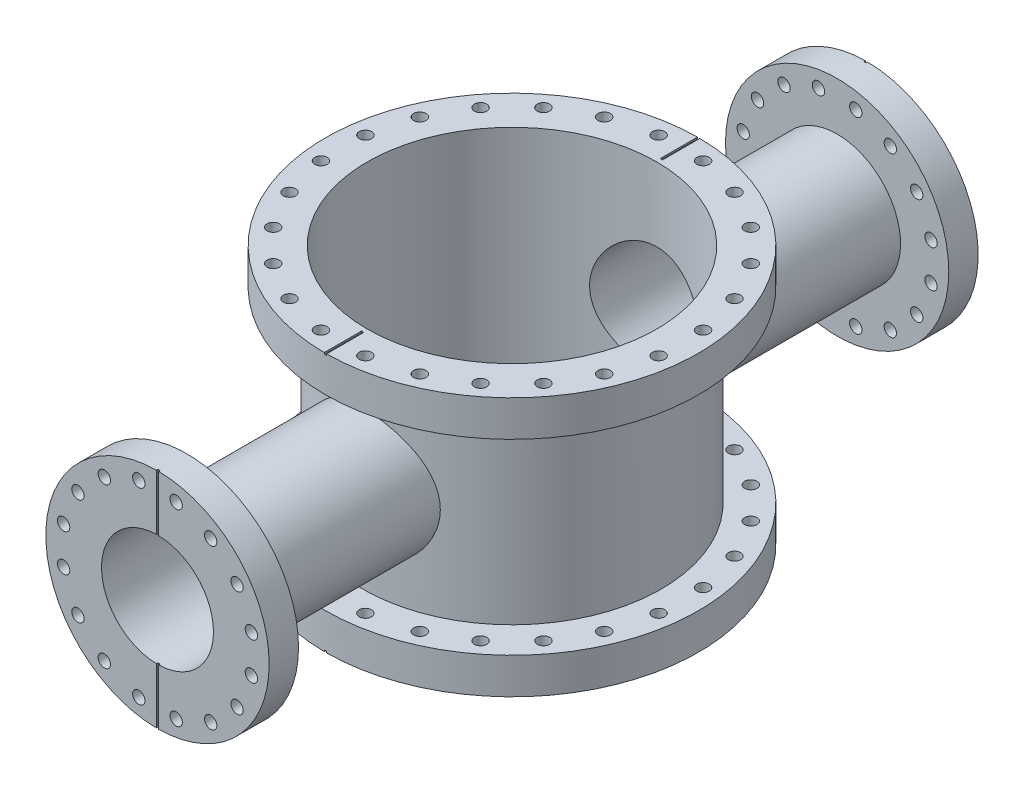
from build123d import *

# Parameters (mm, degrees)
MAIN_CHAMBER_CYLINDER_DEPTH             = 88.138
MAIN_CHAMBER_CYLINDER_DEPTH_BACK        = 88.138
MAIN_CHAMBER_CYLINDER_CROSS_SECTION_R   = 101.6
MAIN_CHAMBER_CYLINDER_CROSS_SECTION_R_2 = 98.552
SKETCH21_R                              = 127
SKETCH21_R_2                            = 101.6
EXTRUDE2_DEPTH                          = 24.5
SKETCH5_W                               = 1.5875
SKETCH5_H                               = 50.8
EXTRUDE3_DEPTH                          = 1.016
HOLE5_D                                 = 8.4
CIRPATTERN7_COUNT                       = 24
EXTRUDE21_START                         = -24.5
SKETCH22_R                              = 127
SKETCH22_R_2                            = 101.6
EXTRUDE21_DEPTH                         = 24.5
SKETCH51_W                              = 1.5875
SKETCH51_H                              = 50.8
EXTRUDE31_DEPTH                         = 1.016
HOLE51_D                                = 8.4
CIRPATTERN71_COUNT                      = 24
EXTRUDE32_REACH                         = 401.427
EXTRUDE32_END_RADIUS                    = 101.6
SKETCH92_R                              = 43.18
SKETCH92_R_2                            = 38.1
EXTRUDE33_REACH                         = 401.427
SKETCH93_R                              = 38.1
SKETCH23_R                              = 76.0000004
SKETCH23_R_2                            = 38.1
EXTRUDE22_DEPTH                         = 20
SKETCH52_W                              = 1.5875
SKETCH52_H                              = 152.0000008
EXTRUDE35_DEPTH                         = 1.016
EXTRUDE4_REACH                          = 401.427
SKETCH8_R                               = 4.2
CIRPATTERN1_COUNT                       = 16
SKETCH24_R                              = 76.0000004
SKETCH24_R_2                            = 38.1
EXTRUDE23_DEPTH                         = 20
SKETCH53_W                              = 1.5875
SKETCH53_H                              = 152.0000008
EXTRUDE37_DEPTH                         = 1.016
EXTRUDE41_REACH                         = 508.754
SKETCH81_R                              = 4.2
CIRPATTERN11_COUNT                      = 16


with BuildPart() as part:
    # Main_Chamber_Cylinder_Cross_Section → Main_Chamber_Cylinder (new, two sides: drawn at the far end of the back side and taken through both)
    with BuildSketch(Plane(origin=(0, 0, 0), x_dir=(1, 0, 0), z_dir=(0, 1, 0)).offset(-MAIN_CHAMBER_CYLINDER_DEPTH_BACK)):
        with Locations(Location((0, 0, 0), (0, 0, 270))):
            Circle(MAIN_CHAMBER_CYLINDER_CROSS_SECTION_R)
        with Locations(Location((0, 0, 0), (0, 0, 270))):
            Circle(MAIN_CHAMBER_CYLINDER_CROSS_SECTION_R_2, mode=Mode.SUBTRACT)
    extrude(amount=MAIN_CHAMBER_CYLINDER_DEPTH + MAIN_CHAMBER_CYLINDER_DEPTH_BACK)

    # Sketch21 → Extrude2 (add)
    with BuildSketch(Plane.XZ.offset(88.138)):
        with Locations(Location((0, 0, 0), (0, 0, 270))):
            Circle(SKETCH21_R)
        with Locations(Location((0, 0, 0), (0, 0, 270))):
            Circle(SKETCH21_R_2, mode=Mode.SUBTRACT)
    extrude(amount=-EXTRUDE2_DEPTH)

    # Sketch5 → Extrude3 (cut)
    with BuildSketch(Plane.XZ.offset(88.138)):
        with Locations((0, 127.0500126)):
            Rectangle(SKETCH5_W, SKETCH5_H)
        with Locations((0, -127.0500126)):
            Rectangle(SKETCH5_W, SKETCH5_H)
    extrude(amount=-EXTRUDE3_DEPTH, mode=Mode.SUBTRACT)

    # Hole5 (through all)
    with Locations(Plane(origin=(15.131327149, -88.138, 114.933840422), x_dir=(0, 0, -1), z_dir=(0, -1, 0))):
        with Locations((0, 0)):
            hole5 = Hole(HOLE5_D / 2)

    # CirPattern7: Hole5 ×24 about axis
    cirpattern7_axis = Axis((0, 0, 0), (0, 1, 0))
    for i in range(1, CIRPATTERN7_COUNT):
        add(hole5.rotate(cirpattern7_axis, i * 360 / CIRPATTERN7_COUNT), mode=Mode.SUBTRACT)

    # Sketch22 → Extrude21 (add)
    with BuildSketch(Plane(origin=(0, 88.138, 0), x_dir=(-1, 0, 0), z_dir=(0, 1, 0)).offset(EXTRUDE21_START)):
        with Locations(Location((0, 0, 0), (0, 0, 270))):
            Circle(SKETCH22_R)
        with Locations(Location((0, 0, 0), (0, 0, 270))):
            Circle(SKETCH22_R_2, mode=Mode.SUBTRACT)
    extrude(amount=EXTRUDE21_DEPTH)

    # Sketch51 → Extrude31 (cut)
    with BuildSketch(Plane(origin=(0, 88.138, 0), x_dir=(-1, 0, 0), z_dir=(0, 1, 0))):
        with Locations((0, -127.0500126)):
            Rectangle(SKETCH51_W, SKETCH51_H)
        with Locations((0, 127.0500126)):
            Rectangle(SKETCH51_W, SKETCH51_H)
    extrude(amount=-EXTRUDE31_DEPTH, mode=Mode.SUBTRACT)

    # Hole51 (through all)
    with Locations(Plane(origin=(15.131327149, 88.138, -114.933840422), x_dir=(0, 0, 1), z_dir=(0, 1, 0))):
        with Locations((0, 0)):
            hole51 = Hole(HOLE51_D / 2)

    # CirPattern71: Hole51 ×24 about axis
    cirpattern71_axis = Axis((0, 0, 0), (0, 1, 0))
    for i in range(1, CIRPATTERN71_COUNT):
        add(hole51.rotate(cirpattern71_axis, i * 360 / CIRPATTERN71_COUNT), mode=Mode.SUBTRACT)

    # Extrude32: up to this cylinder (the profile starts outside it)
    extrude32_end = Plane(origin=(0, 0, 0), z_dir=(0, -1, 0)) * Cylinder(EXTRUDE32_END_RADIUS, 1007.054, mode=Mode.PRIVATE)
    # Sketch92 → Extrude32 (add, up to the surface)
    with BuildSketch(Plane.XY.offset(241.3), mode=Mode.PRIVATE) as extrude32_sk1:
        Circle(SKETCH92_R)
        Circle(SKETCH92_R_2, mode=Mode.SUBTRACT)
    extrude32_tool1 = extrude(extrude32_sk1.sketch, amount=-EXTRUDE32_REACH, mode=Mode.PRIVATE) - extrude32_end
    extrude32 = extrude32_tool1.solids().sort_by_distance((-41.958685, 0, 241.3))[0]
    add(extrude32)

    # Sketch93 → Extrude33 (cut, up to next)
    with BuildSketch(Plane.XY.offset(241.3), mode=Mode.PRIVATE) as extrude33_sk1:
        Circle(SKETCH93_R)
    extrude33_tool1 = extrude(extrude33_sk1.sketch, amount=-EXTRUDE33_REACH, mode=Mode.PRIVATE) & part.part
    extrude33 = extrude33_tool1.solids().sort_by_distance((0, 0, 241.3))[0]
    add(extrude33, mode=Mode.SUBTRACT)

    # Sketch23 → Extrude22 (add)
    with BuildSketch(Plane.XY.offset(241.3)):
        Circle(SKETCH23_R)
        Circle(SKETCH23_R_2, mode=Mode.SUBTRACT)
    extrude(amount=-EXTRUDE22_DEPTH)

    # Sketch52 → Extrude35 (cut)
    with BuildSketch(Plane.XY.offset(241.3)):
        Rectangle(SKETCH52_W, SKETCH52_H)
    extrude(amount=-EXTRUDE35_DEPTH, mode=Mode.SUBTRACT)

    # Sketch8 → Extrude4 (cut, up to next)
    with BuildSketch(Plane.XY.offset(241.3), mode=Mode.PRIVATE) as extrude4_sk1:
        with Locations((12.710134479, 63.898161018)):
            Circle(SKETCH8_R)
    extrude4_tool1 = extrude(extrude4_sk1.sketch, amount=-EXTRUDE4_REACH, mode=Mode.PRIVATE) & part.part
    extrude4 = extrude4_tool1.solids().sort_by_distance((12.710134, 63.898161, 241.3))[0]
    add(extrude4, mode=Mode.SUBTRACT)

    # CirPattern1: Extrude4 ×16 about axis
    cirpattern1_axis = Axis((0, 0, 0), (0, 0, 1))
    for i in range(1, CIRPATTERN1_COUNT):
        add(extrude4.rotate(cirpattern1_axis, i * 360 / CIRPATTERN1_COUNT), mode=Mode.SUBTRACT)

    # Mirror2: Extrude32, Extrude33 across plane
    add(extrude32.mirror(Plane.XY))
    add(extrude33.mirror(Plane.XY), mode=Mode.SUBTRACT)

    # Sketch24 → Extrude23 (add)
    with BuildSketch(Plane(origin=(0, 0, -241.3), x_dir=(-1, 0, 0), z_dir=(0, 0, -1))):
        with Locations(Location((0, 0, 0), (0, 0, 180))):
            Circle(SKETCH24_R)
        with Locations(Location((0, 0, 0), (0, 0, 180))):
            Circle(SKETCH24_R_2, mode=Mode.SUBTRACT)
    extrude(amount=-EXTRUDE23_DEPTH)

    # Sketch53 → Extrude37 (cut)
    with BuildSketch(Plane(origin=(0, 0, -241.3), x_dir=(-1, 0, 0), z_dir=(0, 0, -1))):
        Rectangle(SKETCH53_W, SKETCH53_H)
    extrude(amount=-EXTRUDE37_DEPTH, mode=Mode.SUBTRACT)

    # Sketch81 → Extrude41 (cut, up to next)
    with BuildSketch(Plane(origin=(0, 0, -241.3), x_dir=(-1, 0, 0), z_dir=(0, 0, -1)), mode=Mode.PRIVATE) as extrude41_sk1:
        with Locations(Location((12.710134479, 63.898161018, 0), (0, 0, 180))):
            Circle(SKETCH81_R)
    extrude41_tool1 = extrude(extrude41_sk1.sketch, amount=-EXTRUDE41_REACH, mode=Mode.PRIVATE) & part.part
    extrude41 = extrude41_tool1.solids().sort_by_distance((-12.710134, 63.898161, -241.3))[0]
    add(extrude41, mode=Mode.SUBTRACT)

    # CirPattern11: Extrude41 ×16 about axis
    cirpattern11_axis = Axis((0, 0, 0), (0, 0, 1))
    for i in range(1, CIRPATTERN11_COUNT):
        add(extrude41.rotate(cirpattern11_axis, i * 360 / CIRPATTERN11_COUNT), mode=Mode.SUBTRACT)


solid = part.part
